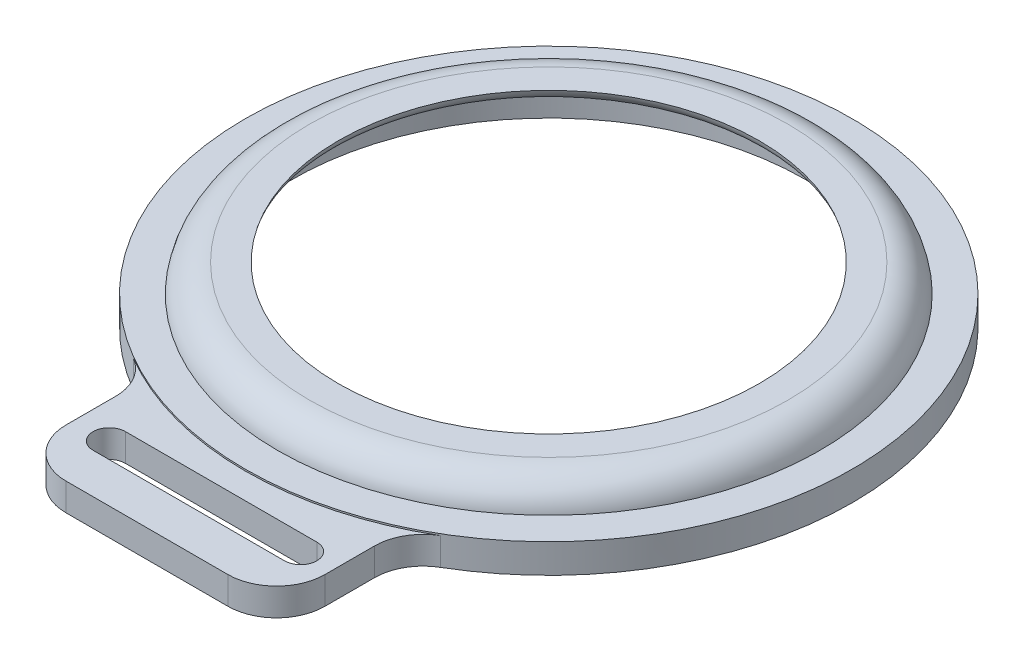
from build123d import *

# Parameters (mm, degrees)
SKETCH1_R           = 18.75
BOSS_EXTRUDE1_DEPTH = 1.8
SKETCH2_R           = 16.75
BOSS_EXTRUDE2_DEPTH = 1.7
SKETCH3_R           = 13
CUT_EXTRUDE1_DEPTH  = 5.7
FILLET1_R           = 2
SKETCH4_R           = 15.85
CUT_EXTRUDE2_DEPTH  = 2.7
FILLET2_R           = 1
BOSS_EXTRUDE3_DEPTH = 1.7


with BuildPart() as part:
    # Sketch1 → Boss-Extrude1 (new body)
    with BuildSketch(Plane(origin=(0, 0, 0), x_dir=(1, 0, 0), z_dir=(0, 1, 0))):
        with Locations(Location((0, 0, 0), (0, 0, 270))):
            Circle(SKETCH1_R)
    extrude(amount=BOSS_EXTRUDE1_DEPTH)

    # Sketch2 → Boss-Extrude2 (add)
    with BuildSketch(Plane(origin=(0, 1.8, 0), x_dir=(1, 0, 0), z_dir=(0, 1, 0))):
        with Locations(Location((0, 0, 0), (0, 0, 270))):
            Circle(SKETCH2_R)
    extrude(amount=BOSS_EXTRUDE2_DEPTH)

    # Sketch3 → Cut-Extrude1 (cut)
    with BuildSketch(Plane(origin=(0, 3.5, 0), x_dir=(1, 0, 0), z_dir=(0, 1, 0))):
        with Locations(Location((0, 0, 0), (0, 0, 270))):
            Circle(SKETCH3_R)
    extrude(amount=-CUT_EXTRUDE1_DEPTH, mode=Mode.SUBTRACT)

    # Fillet1
    # the kernel refuses this fillet: 2 mm, written as the material it takes off along each edge
    with BuildSketch(Plane(origin=(0, 3.5, 0), x_dir=(0, 0, 1), z_dir=(-1, 0, 0))) as fillet1_piece_1:
        with BuildLine():
            CenterArc((14.772628007, -2), FILLET1_R, 8.626926559, 81.373073441)
            Line((14.772628007, 0), (14.772628007, 0.04))
            Line((14.772628007, 0.04), (16.75, 0.04))
            Line((16.75, 0.04), (16.79, 0))
            ThreePointArc((16.79, 0), (16.79, -0.85), (16.78954744, -1.694))
            Line((16.78954744, -1.694), (16.75, -1.7))
        make_face()
    revolve(axis=Axis((0, 3.5, 0), (0, 1, 0)), mode=Mode.SUBTRACT)

    # Sketch4 → Cut-Extrude2 (cut)
    with BuildSketch(Plane.XZ):
        with Locations(Location((0, 0, 0), (0, 0, 270))):
            Circle(SKETCH4_R)
    extrude(amount=-CUT_EXTRUDE2_DEPTH, mode=Mode.SUBTRACT)

    # Fillet2
    # the kernel refuses this fillet: 1 mm, written as the material it adds along each edge
    with BuildSketch(Plane(origin=(0, 2.7, 0), x_dir=(0, 0, -1), z_dir=(-1, 0, 0))) as fillet2_piece_1:
        with BuildLine():
            CenterArc((15.85 - FILLET2_R, FILLET2_R), FILLET2_R, 270, 90)
            Line((15.85 - FILLET2_R, 0), (15.85, 0))
            Line((15.85, 0), (15.85, FILLET2_R))
        make_face()
    revolve(axis=Axis((0, 2.7, 0), (0, -1, 0)))
    # the kernel refuses this fillet: 1 mm, written as the material it takes off along each edge
    with BuildSketch(Plane(origin=(0, 2.7, 0), x_dir=(0, 0, 1), z_dir=(-1, 0, 0))) as fillet2_2_piece_1:
        with BuildLine():
            CenterArc((13.979795897, 1), FILLET2_R, 191.536959033, 78.463040967)
            Line((13, 0.8), (13, 0))
            Line((13, 0), (13.979795897, 0))
        make_face()
    revolve(axis=Axis((0, 2.7, 0), (0, 1, 0)), mode=Mode.SUBTRACT)

    # Sketch5 → Boss-Extrude3 (add)
    with BuildSketch(Plane.XZ):
        with BuildLine():
            Line((-8, 18.763328596), (-8, 21.82057613))
            ThreePointArc((-8, 21.82057613), (-7.121320344, 23.941896474), (-5, 24.82057613))
            Line((-5, 24.82057613), (5, 24.82057613))
            ThreePointArc((5, 24.82057613), (7.121320344, 23.941896474), (8, 21.82057613))
            Line((8, 21.82057613), (8, 18.763328596))
            ThreePointArc((8, 18.763328596), (8.396951389, 17.271974201), (9.482758621, 16.175283272))
            ThreePointArc((9.482758621, 16.175283272), (0, 18.75), (-9.482758621, 16.175283272))
            ThreePointArc((-9.482758621, 16.175283272), (-8.396951389, 17.271974201), (-8, 18.763328596))
        make_face()
        with BuildLine():
            Line((-5.808489471, 22.338127717), (6.015887115, 22.338127717))
            ThreePointArc((6.015887115, 22.338127717), (7.015887115, 21.338127717), (6.015887115, 20.338127717))
            Line((6.015887115, 20.338127717), (-5.808489471, 20.338127717))
            ThreePointArc((-5.808489471, 20.338127717), (-6.808489471, 21.338127717), (-5.808489471, 22.338127717))
        make_face(mode=Mode.SUBTRACT)
    extrude(amount=-BOSS_EXTRUDE3_DEPTH)


solid = part.part
